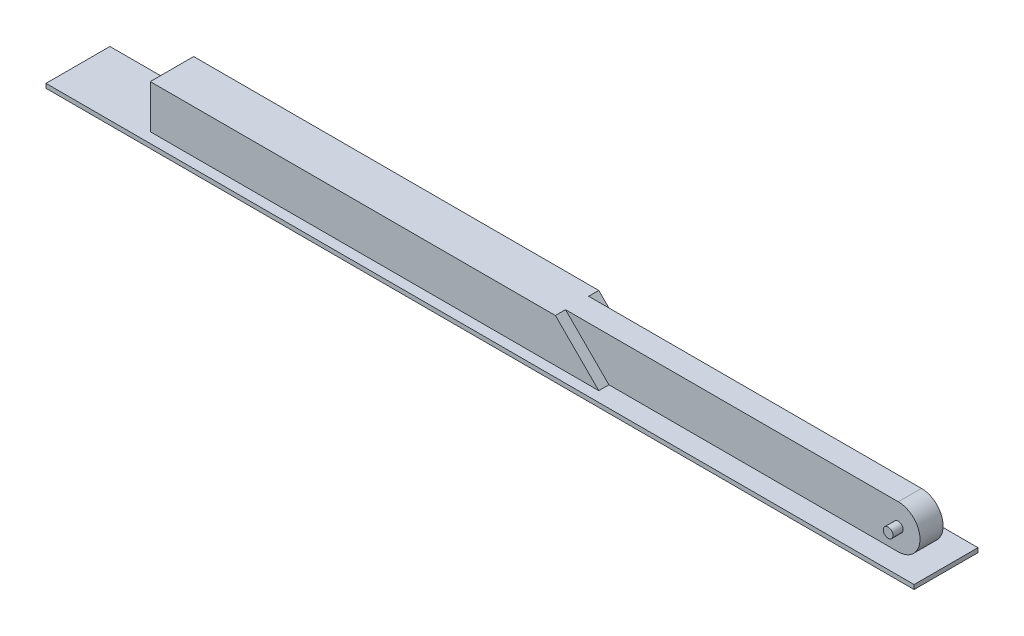
from build123d import *

# Parameters (mm, degrees)
BOSS_EXTRUDE1_DEPTH             = 15
H_0_266_DIAMETER_HOLE1_D        = 6.7564
SKETCH5_W                       = 40
SKETCH5_H                       = 16
SKETCH5_W_2                     = 232
SKETCH5_H_2                     = 20.916111238
CUT_EXTRUDE1_DEPTH              = 243.332416321
SKETCH6_W                       = 237.036778435
SKETCH6_H                       = 127.431795429
CUT_EXTRUDE2_DEPTH              = 243.332416321
SKETCH10_W                      = 30
SKETCH10_H                      = 30
BOSS_EXTRUDE3_DEPTH             = 300
SKETCH11_R                      = 6.35
CUT_EXTRUDE4_DEPTH              = 400
SKETCH13_W                      = 600
SKETCH13_H                      = 44.158972604
BOSS_EXTRUDE4_DEPTH             = 3
SKETCH14_W                      = 268.104744415
SKETCH14_H                      = 124.61591485
CUT_EXTRUDE5_DEPTH              = 30
SKETCH15_W                      = 12.7
SKETCH15_H                      = 12.7
CUT_EXTRUDE6_DEPTH              = 385
BOSS_EXTRUDE5_REACH             = 353.137
SKETCH16_R                      = 3.3782
BOSS_EXTRUDE5_DIRECTION_2_REACH = 353.137
CHAMFER1_SIZE                   = 30


with BuildPart() as part:
    # Sketch1 → Boss-Extrude1 (new, symmetric)
    with BuildSketch(Plane.XY):
        with BuildLine():
            Line((-225, 15), (225, 15))
            ThreePointArc((225, 15), (240, 0), (225, -15))
            Line((225, -15), (-225, -15))
            ThreePointArc((-225, -15), (-240, 0), (-225, 15))
        make_face()
    extrude(amount=BOSS_EXTRUDE1_DEPTH, both=True)

    # H (0.266) Diameter Hole1 (through all)
    with Locations(Plane.XY.offset(15)):
        with Locations((-225, 0), (225, 0)):
            Hole(H_0_266_DIAMETER_HOLE1_D / 2)

    # Sketch5 → Cut-Extrude1 (cut, through all)
    with BuildSketch(Plane(origin=(0, 15, 0), x_dir=(1, 0, 0), z_dir=(0, 1, 0))):
        with Locations((-237, 0)):
            Rectangle(SKETCH5_W, SKETCH5_H)
        with Locations((141, 18.458055619)):
            Rectangle(SKETCH5_W_2, SKETCH5_H_2)
        with Locations((141, -18.458055619)):
            Rectangle(SKETCH5_W_2, SKETCH5_H_2)
    extrude(amount=-CUT_EXTRUDE1_DEPTH, mode=Mode.SUBTRACT)

    # Sketch6 → Cut-Extrude2 (cut, through all)
    with BuildSketch(Plane(origin=(0, 15, 0), x_dir=(1, 0, 0), z_dir=(0, 1, 0))):
        with Locations((-293.518389218, -4.674139215)):
            Rectangle(SKETCH6_W, SKETCH6_H)
    extrude(amount=-CUT_EXTRUDE2_DEPTH, mode=Mode.SUBTRACT)

    # Sketch10 → Boss-Extrude3 (add)
    with BuildSketch(Plane.ZY.offset(175)):
        Rectangle(SKETCH10_W, SKETCH10_H)
    extrude(amount=BOSS_EXTRUDE3_DEPTH)

    # Sketch11 → Cut-Extrude4 (cut)
    with BuildSketch(Plane.ZY.offset(475)):
        with Locations((0, 3)):
            Circle(SKETCH11_R)
    extrude(amount=-CUT_EXTRUDE4_DEPTH, mode=Mode.SUBTRACT)

    # Sketch13 → Boss-Extrude4 (add)
    with BuildSketch(Plane(origin=(0, -15, 0), x_dir=(-1, 0, 0), z_dir=(0, -1, 0))):
        with Locations((49.98, 0)):
            Rectangle(SKETCH13_W, SKETCH13_H)
    extrude(amount=BOSS_EXTRUDE4_DEPTH)

    # Sketch14 → Cut-Extrude5 (cut)
    with BuildSketch(Plane(origin=(0, 15, 0), x_dir=(1, 0, 0), z_dir=(0, 1, 0))):
        with Locations((-419.052372208, 3.913950599)):
            Rectangle(SKETCH14_W, SKETCH14_H)
    extrude(amount=-CUT_EXTRUDE5_DEPTH, mode=Mode.SUBTRACT)

    # Sketch15 → Cut-Extrude6 (cut)
    with BuildSketch(Plane.ZY.offset(285)):
        with Locations((0, 3)):
            Rectangle(SKETCH15_W, SKETCH15_H)
    extrude(amount=-CUT_EXTRUDE6_DEPTH, mode=Mode.SUBTRACT)

    # Boss-Extrude5: up to this face of the body (flat: up to its plane)
    boss_extrude5_end = Plane(part.part.faces().sort_by_distance((-130, 0, 15))[0])
    # Sketch16 → Boss-Extrude5 (add, up to the picked face)
    with BuildSketch(Plane.XY, mode=Mode.PRIVATE) as boss_extrude5_sk1:
        with Locations((225, 0)):
            Circle(SKETCH16_R)
    boss_extrude5_tool1 = split(extrude(boss_extrude5_sk1.sketch, amount=BOSS_EXTRUDE5_REACH, mode=Mode.PRIVATE), bisect_by=boss_extrude5_end, keep=Keep.BOTH, mode=Mode.PRIVATE)
    add(boss_extrude5_tool1.solids().sort_by(Axis((225, 0, 0), (0, 0, 1)))[0])

    # Boss-Extrude5 direction 2: up to this face of the body (flat: up to its plane)
    boss_extrude5_direction_2_end = Plane(part.part.faces().sort_by_distance((-130, 0, -15))[0])
    # Sketch16 → Boss-Extrude5 direction 2 (add, up to the picked face)
    with BuildSketch(Plane.XY, mode=Mode.PRIVATE) as boss_extrude5_direction_2_sk1:
        with Locations((225, 0)):
            Circle(SKETCH16_R)
    boss_extrude5_direction_2_tool1 = split(extrude(boss_extrude5_direction_2_sk1.sketch, amount=-BOSS_EXTRUDE5_DIRECTION_2_REACH, mode=Mode.PRIVATE), bisect_by=boss_extrude5_direction_2_end, keep=Keep.BOTH, mode=Mode.PRIVATE)
    add(boss_extrude5_direction_2_tool1.solids().sort_by(Axis((225, 0, 0), (0, 0, -1)))[0])

    # Chamfer1
    chamfer1_edges = [part.edges().sort_by_distance(p)[0] for p in [
        (25, 15, 11.5),
        (25, 15, -11.5),
    ]]
    chamfer(chamfer1_edges, length=CHAMFER1_SIZE - 0.0001)  # a hair under: the kernel refuses the full size


solid = part.part
